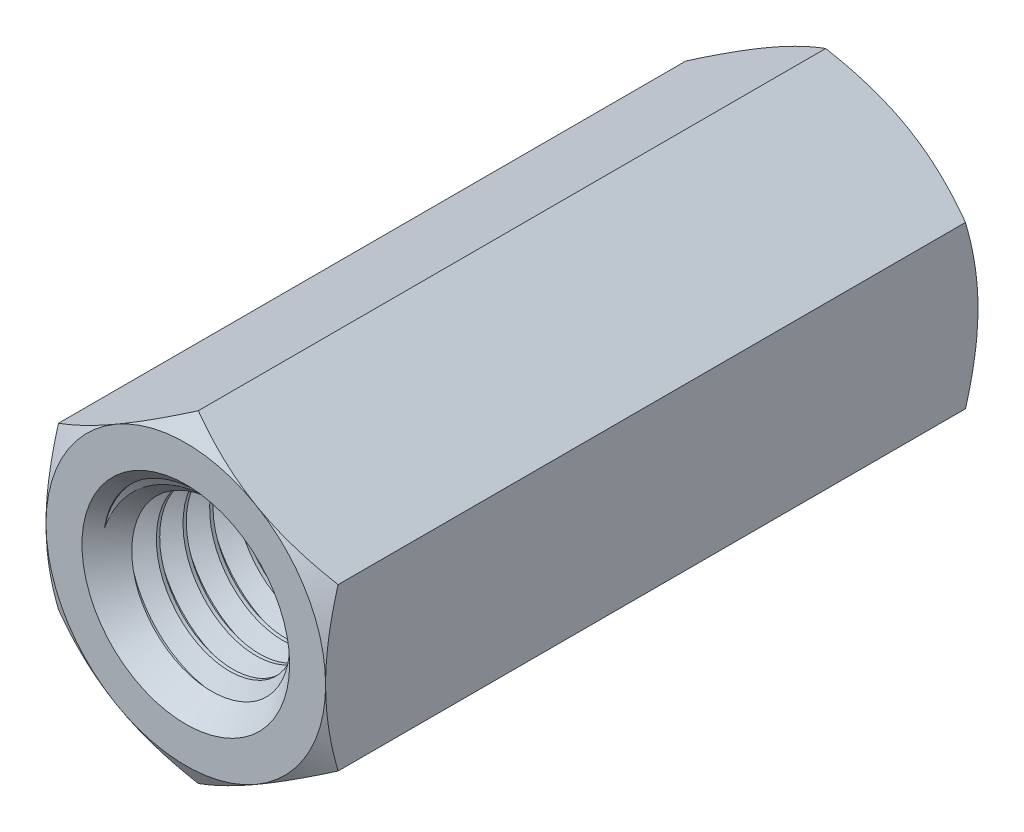
from build123d import *

# Parameters (mm, degrees)
EXTRUDE1_DEPTH     = 22.225
SKETCH2_OUTSIDE_W  = 101.311
SKETCH2_OUTSIDE_H  = 102.784
SKETCH2_OUTSIDE_R  = 4.7625
CUT_EXTRUDE1_DEPTH = 24.385335282
CUT_EXTRUDE1_DRAFT = -60
SKETCH3_OUTSIDE_W  = 101.312
SKETCH3_OUTSIDE_H  = 102.784
SKETCH3_OUTSIDE_R  = 4.7625
CUT_EXTRUDE2_DEPTH = 24.385335282
CUT_EXTRUDE2_DRAFT = -60
SKETCH4_R          = 3.175
CUT_EXTRUDE3_DEPTH = 24.385335282
SKETCH12_R         = 3.175
SKETCH12_R_2       = 2.585793431
EXTRUDE2_DEPTH     = 22.225
CUT_SWEEP1_PITCH   = 0.907142857


with BuildPart() as part:
    # Sketch1 → Extrude1 (new body)
    with BuildSketch(Plane.XY):
        Polygon((0, 5.499261314), (-4.7625, 2.749630657), (-4.7625, -2.749630657), (0, -5.499261314), (4.7625, -2.749630657), (4.7625, 2.749630657), align=None)
    extrude(amount=-EXTRUDE1_DEPTH)


with BuildPart() as cut_extrude1_tool:
    # Sketch2 outside → Cut-Extrude1 (with draft: the straight prism first)
    with BuildSketch(Plane.XY):
        with Locations((-0.0005, 0)):
            Rectangle(SKETCH2_OUTSIDE_W, SKETCH2_OUTSIDE_H)
        Circle(SKETCH2_OUTSIDE_R, mode=Mode.SUBTRACT)
    extrude(amount=-CUT_EXTRUDE1_DEPTH)
    # Cut-Extrude1: the draft: its side faces are tilted about the plane it starts from
    cut_extrude1_sides = [cut_extrude1_tool.faces().sort_by_distance(p)[0] for p in [
        (-0.0005, -51.392, -12.192667641),
        (50.655, 0, -12.192667641),
        (-0.0005, 51.392, -12.192667641),
        (-50.656, 0, -12.192667641),
        (-4.7625, 0, -12.192667641),
    ]]
    draft(cut_extrude1_sides, Plane.XY, CUT_EXTRUDE1_DRAFT)


with BuildPart() as part_1:
    add(part.part)

    # Cut-Extrude1: cut by cut_extrude1_tool
    add(cut_extrude1_tool.part, mode=Mode.SUBTRACT)


with BuildPart() as cut_extrude2_tool:
    # Sketch3 outside → Cut-Extrude2 (with draft: the straight prism first)
    with BuildSketch(Plane(origin=(0, 0, -22.225), x_dir=(-1, 0, 0), z_dir=(0, 0, -1))):
        Rectangle(SKETCH3_OUTSIDE_W, SKETCH3_OUTSIDE_H)
        Circle(SKETCH3_OUTSIDE_R, mode=Mode.SUBTRACT)
    extrude(amount=-CUT_EXTRUDE2_DEPTH)
    # Cut-Extrude2: the draft: its side faces are tilted about the plane it starts from
    cut_extrude2_sides = [cut_extrude2_tool.faces().sort_by_distance(p)[0] for p in [
        (0, -51.392, -10.032332359),
        (-50.656, 0, -10.032332359),
        (0, 51.392, -10.032332359),
        (50.656, 0, -10.032332359),
        (4.7625, 0, -10.032332359),
    ]]
    draft(cut_extrude2_sides, Plane(origin=(0, 0, -22.225), x_dir=(-1, 0, 0), z_dir=(0, 0, -1)), CUT_EXTRUDE2_DRAFT)


with BuildPart() as part_2:
    add(part_1.part)

    # Cut-Extrude2: cut by cut_extrude2_tool
    add(cut_extrude2_tool.part, mode=Mode.SUBTRACT)

    # Sketch4 → Cut-Extrude3 (cut, through all)
    with BuildSketch(Plane.XY):
        Circle(SKETCH4_R)
    extrude(amount=-CUT_EXTRUDE3_DEPTH, mode=Mode.SUBTRACT)

    # Sketch12 → Extrude2 (add)
    with BuildSketch(Plane.XY):
        Circle(SKETCH12_R)
        Circle(SKETCH12_R_2, mode=Mode.SUBTRACT)
    extrude(amount=-EXTRUDE2_DEPTH)

    # Cut-Sweep1: the profile of Sketch9 profile screwed along a right-hand helix of 25.5 turns, 6 arcs to a turn; built about Z, then put on its axis
    cut_sweep1_z = Axis((0, 0, 0), (0, 0, 1))
    cut_sweep1_corners = [(3.175, 0, -0.453571429), (3.175, 0, -0.340178571), (2.585493431, 0, 0.000173205), (2.585493431, 0, -0.793923205)]
    with BuildLine(mode=Mode.PRIVATE) as cut_sweep1_profile:
        Line(cut_sweep1_corners[0], cut_sweep1_corners[1])
        Line(cut_sweep1_corners[1], cut_sweep1_corners[2])
        Line(cut_sweep1_corners[2], cut_sweep1_corners[3])
        Line(cut_sweep1_corners[3], cut_sweep1_corners[0])
    cut_sweep1_cap = Face(cut_sweep1_profile.wire())
    cut_sweep1_turn_angles = [0, 30, 60, 90, 120, 150, 180, 210, 240, 270, 300, 330, 360]
    cut_sweep1_turn_weights = [1, 0.8660254037844387, 1, 0.8660254037844387, 1, 0.8660254037844387, 1, 0.8660254037844387, 1, 0.8660254037844387, 1, 0.8660254037844387, 1]
    cut_sweep1_turn_rails = [Edge.make_bspline([Vector(p[0], p[1], 0).rotate(cut_sweep1_z, cut_sweep1_turn_angles[k]) / cut_sweep1_turn_weights[k] + Vector(0, 0, p[2] + CUT_SWEEP1_PITCH * cut_sweep1_turn_angles[k] / 360) for k in range(13)], [0, 0, 0, 1, 1, 2, 2, 3, 3, 4, 4, 5, 5, 6, 6, 6], 2, cut_sweep1_turn_weights) for p in cut_sweep1_corners]
    cut_sweep1_turn_sides = [Face.make_surface_from_curves(cut_sweep1_turn_rails[p[0]], cut_sweep1_turn_rails[p[1]]) for p in [(0, 1), (1, 2), (2, 3), (3, 0)]]
    cut_sweep1_last_angles = [9000, 9030, 9060, 9090, 9120, 9150, 9180]
    cut_sweep1_last_weights = [1, 0.8660254037844387, 1, 0.8660254037844387, 1, 0.8660254037843355, 1]
    cut_sweep1_last_rails = [Edge.make_bspline([Vector(p[0], p[1], 0).rotate(cut_sweep1_z, cut_sweep1_last_angles[k]) / cut_sweep1_last_weights[k] + Vector(0, 0, p[2] + CUT_SWEEP1_PITCH * cut_sweep1_last_angles[k] / 360) for k in range(7)], [0, 0, 0, 1, 1, 2, 2, 3, 3, 3], 2, cut_sweep1_last_weights) for p in cut_sweep1_corners]
    cut_sweep1_last_sides = [Face.make_surface_from_curves(cut_sweep1_last_rails[p[0]], cut_sweep1_last_rails[p[1]]) for p in [(0, 1), (1, 2), (2, 3), (3, 0)]]
    cut_sweep1 = Plane(origin=(0, 0, 0), x_dir=(0, 1, 0), z_dir=(0, 0, -1)) * Solid(Shell([*[p.moved(Location((0, 0, CUT_SWEEP1_PITCH * i))) for i in range(25) for p in cut_sweep1_turn_sides], *cut_sweep1_last_sides, cut_sweep1_cap, cut_sweep1_cap.rotate(cut_sweep1_z, 9180).moved(Location((0, 0, CUT_SWEEP1_PITCH * 9180 / 360)))]))
    add(cut_sweep1, mode=Mode.SUBTRACT)

    # Cut-Extrude6 cone 1 section (through the dimple's axis) → Cut-Extrude6 (revolve, cut)
    with BuildSketch(Plane(origin=(0, 0, 0), x_dir=(0, -1, 0), z_dir=(1, 0, 0))):
        Polygon((0, 0), (3.537857143, 0), (0, 3.537857143), align=None)
    revolve(axis=Axis((0, 0, 0), (0, 0, -1)), mode=Mode.SUBTRACT)

    # Cut-Extrude7 cone 1 section (through the dimple's axis) → Cut-Extrude7 (revolve, cut)
    with BuildSketch(Plane(origin=(0, 0, -22.225), x_dir=(0, 1, 0), z_dir=(1, 0, 0))):
        Polygon((0, 0), (3.537857143, 0), (0, 3.537857143), align=None)
    revolve(axis=Axis((0, 0, -22.225), (0, 0, 1)), mode=Mode.SUBTRACT)


solid = part_2.part
